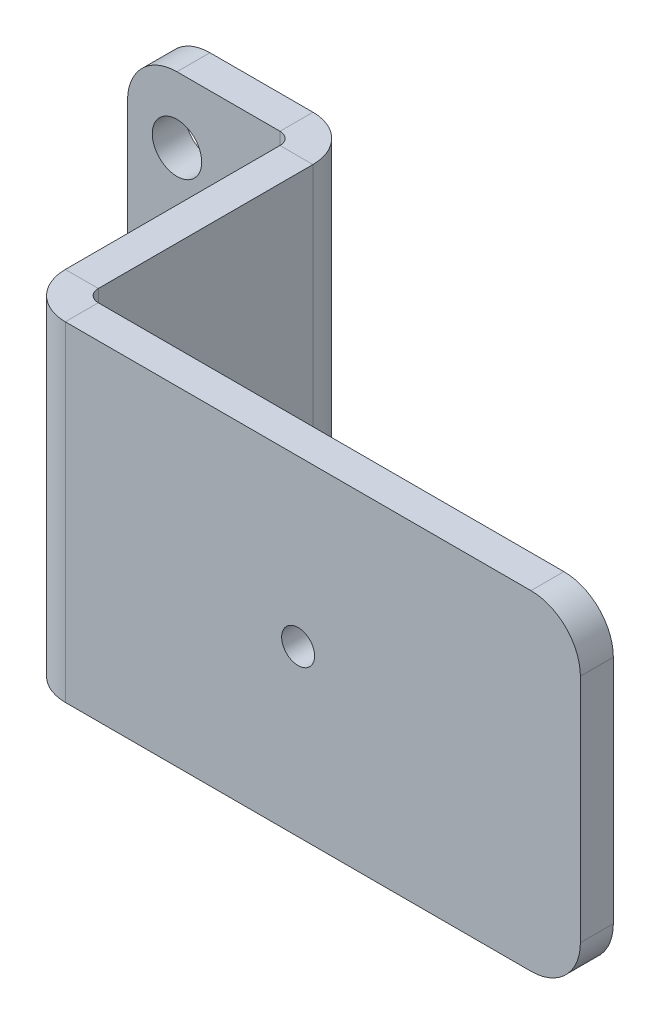
from build123d import *

# Parameters (mm, degrees)
BASE_FLANGE1_DEPTH    = 10
FILLET1_R             = 3
SKETCH7_R             = 1.5
SKETCH7_R_2           = 1
CUT_EXTRUDE1_DEPTH    = 39.303728604
BODY_MOVE_COPY1_ANGLE = 90


# Sheet-metal steps are written as plain solids
with BuildPart() as part:
    # Sketch1 → Base-Flange1 (new, symmetric)
    with BuildSketch(Plane.XY):
        with BuildLine():
            Line((-12, 0), (-2.75, 0))
            ThreePointArc((-2.75, 0), (-0.805456352, 0.805456352), (0, 2.75))
            Line((0, 2.75), (0, 15.775))
            ThreePointArc((0, 15.775), (0.219669914, 16.305330086), (0.75, 16.525))
            Line((0.75, 16.525), (32, 16.525))
            Line((32, 16.525), (32, 18.525))
            Line((32, 18.525), (0.75, 18.525))
            ThreePointArc((0.75, 18.525), (-1.194543648, 17.719543648), (-2, 15.775))
            Line((-2, 15.775), (-2, 2.75))
            ThreePointArc((-2, 2.75), (-2.219669914, 2.219669914), (-2.75, 2))
            Line((-2.75, 2), (-12, 2))
            Line((-12, 2), (-12, 0))
        make_face()
    extrude(amount=BASE_FLANGE1_DEPTH, both=True)

    # Fillet1
    fillet1_edges = [part.edges().sort_by_distance(p)[0] for p in [
        (32, 17.525, -10),
        (-12, 1, -10),
        (32, 17.525, 10),
        (-12, 1, 10),
    ]]
    fillet(fillet1_edges, radius=FILLET1_R)

    # Sketch7 → Cut-Extrude1 (cut, through all)
    with BuildSketch(Plane(origin=(0, 0, 0), x_dir=(1, 0, 0), z_dir=(0, 1, 0))):
        with Locations((-9, 6)):
            Circle(SKETCH7_R)
        with Locations((-9, -6)):
            Circle(SKETCH7_R)
        with Locations(Location((14.875, 0, 0), (0, 0, 90))):
            Circle(SKETCH7_R_2)
    extrude(amount=CUT_EXTRUDE1_DEPTH, mode=Mode.SUBTRACT)


with BuildPart() as part_1:
    # Body-Move/Copy1: moved
    add(part.part.rotate(Axis((0, 7.6, 0), (1, 0, 0)), BODY_MOVE_COPY1_ANGLE))


solid = part_1.part
